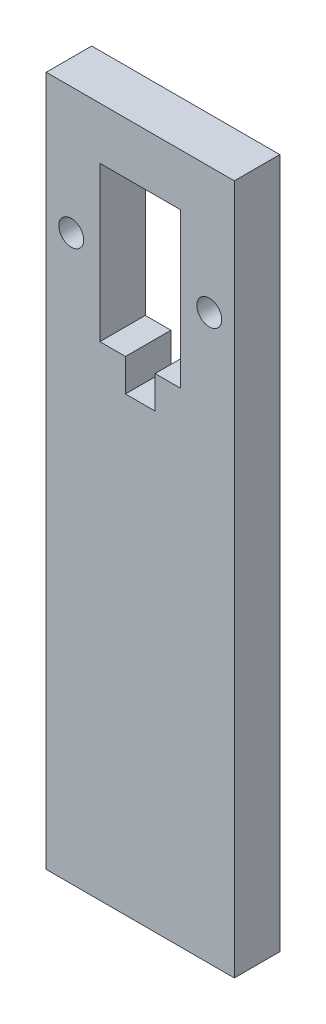
from build123d import *

# Parameters (mm, degrees)
SKETCH1_W           = 28.96
SKETCH1_H           = 74.5
BOSS_EXTRUDE1_DEPTH = 7
SKETCH2_W           = 8.255
SKETCH2_H           = 7
BOSS_EXTRUDE2_DEPTH = 23.8
SKETCH3_W           = 28.96
SKETCH3_H           = 7
BOSS_EXTRUDE3_DEPTH = 8
SKETCH4_W           = 4.56
SKETCH4_H           = 7
CUT_EXTRUDE1_DEPTH  = 5
SKETCH5_R           = 1.92
CUT_EXTRUDE2_DEPTH  = 10


with BuildPart() as part:
    # Sketch1 → Boss-Extrude1 (new body)
    with BuildSketch(Plane.XY):
        with Locations((-4.078230088, -6.160265487)):
            Rectangle(SKETCH1_W, SKETCH1_H)
    extrude(amount=BOSS_EXTRUDE1_DEPTH)

    # Sketch2 → Boss-Extrude2 (add)
    with BuildSketch(Plane(origin=(0, 31.089734513, 0), x_dir=(1, 0, 0), z_dir=(0, 1, 0))):
        with Locations((-14.430730088, -3.5)):
            Rectangle(SKETCH2_W, SKETCH2_H)
        with Locations((6.274269912, -3.5)):
            Rectangle(SKETCH2_W, SKETCH2_H)
    extrude(amount=BOSS_EXTRUDE2_DEPTH)

    # Sketch3 → Boss-Extrude3 (add)
    with BuildSketch(Plane(origin=(0, 54.889734513, 0), x_dir=(1, 0, 0), z_dir=(0, 1, 0))):
        with Locations((-4.078230088, -3.5)):
            Rectangle(SKETCH3_W, SKETCH3_H)
    extrude(amount=BOSS_EXTRUDE3_DEPTH)

    # Sketch4 → Cut-Extrude1 (cut)
    with BuildSketch(Plane(origin=(0, 31.089734513, 0), x_dir=(1, 0, 0), z_dir=(0, 1, 0))):
        with Locations((-4.078230088, -3.5)):
            Rectangle(SKETCH4_W, SKETCH4_H)
    extrude(amount=-CUT_EXTRUDE1_DEPTH, mode=Mode.SUBTRACT)

    # Sketch5 → Cut-Extrude2 (cut)
    with BuildSketch(Plane.XY.offset(7)):
        with Locations((-14.703230088, 43.409734513)):
            Circle(SKETCH5_R)
        with Locations((6.546769912, 43.409734513)):
            Circle(SKETCH5_R)
    extrude(amount=-CUT_EXTRUDE2_DEPTH, mode=Mode.SUBTRACT)


solid = part.part
